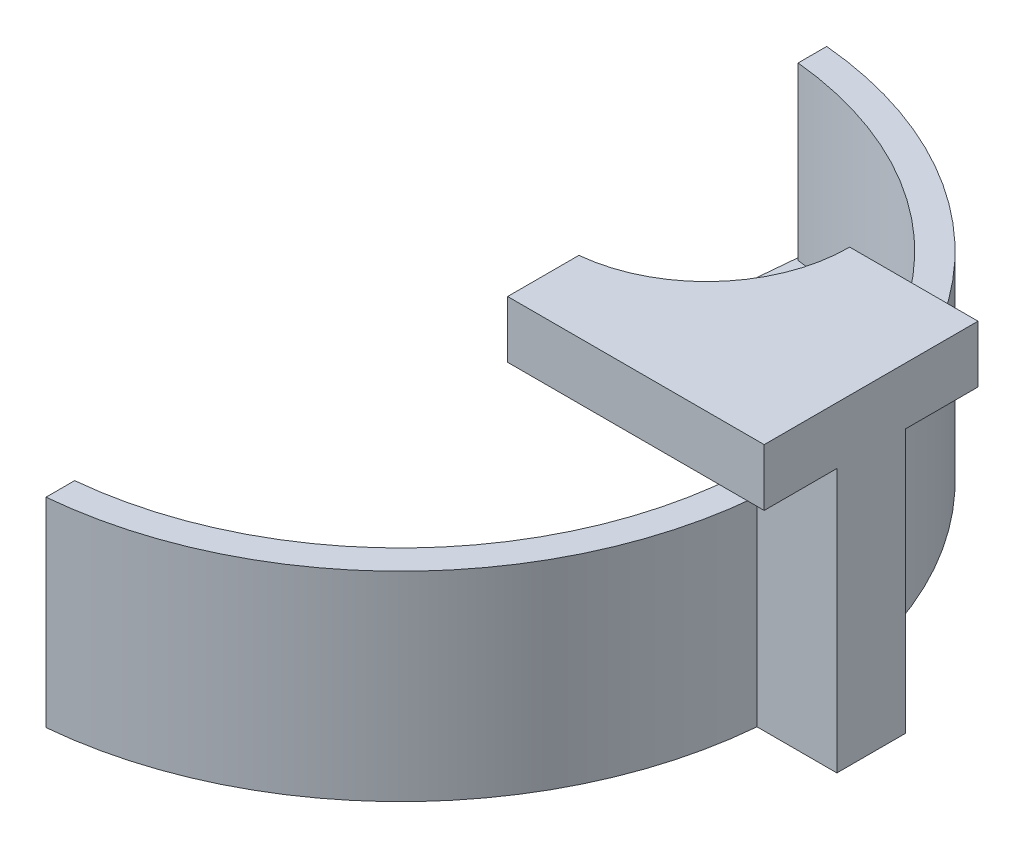
from build123d import *

# Parameters (mm, degrees)
BOSS_EXTRUDE3_DEPTH      = 12
BOSS_EXTRUDE4_START      = -2
BOSS_EXTRUDE4_DEPTH      = 2
SKETCH3_W                = 6
SKETCH3_H                = 4.8
BOSS_EXTRUDE5_DEPTH      = 20
BOSS_EXTRUDE6_DEPTH      = 2.5
BOSS_EXTRUDE6_DEPTH_BACK = 1.5
SKETCH4_W                = 18
SKETCH4_H                = 15
CUT_EXTRUDE2_DEPTH       = 5


with BuildPart() as part:
    # Sketch1 → Boss-Extrude3 (new body)
    with BuildSketch(Plane(origin=(0, 0, 0), x_dir=(1, 0, 0), z_dir=(0, 1, 0))):
        with BuildLine():
            Line((2.5, 27.386127875), (2.5, 25.377155081))
            ThreePointArc((2.5, 25.377155081), (25.5, 0), (2.5, -25.377155081))
            Line((2.5, -25.377155081), (2.5, -27.386127875))
            ThreePointArc((2.5, -27.386127875), (27.5, 0), (2.5, 27.386127875))
        make_face()
    extrude(amount=BOSS_EXTRUDE3_DEPTH)

    # Sketch2 → Boss-Extrude4 (add)
    with BuildSketch(Plane(origin=(0, 0, 0), x_dir=(1, 0, 0), z_dir=(0, 1, 0)).offset(BOSS_EXTRUDE4_START)):
        with BuildLine():
            Line((2.5, 27.386127875), (1.863636364, 20.415113507))
            ThreePointArc((1.863636364, 20.415113507), (20.5, 0), (1.863636364, -20.415113507))
            Line((1.863636364, -20.415113507), (2.5, -27.386127875))
            ThreePointArc((2.5, -27.386127875), (27.5, 0), (2.5, 27.386127875))
        make_face()
    extrude(amount=BOSS_EXTRUDE4_DEPTH)

    # Sketch3 → Boss-Extrude5 (add)
    with BuildSketch(Plane.XZ.offset(2)):
        with Locations((30, 0)):
            Rectangle(SKETCH3_W, SKETCH3_H)
    extrude(amount=-BOSS_EXTRUDE5_DEPTH)

    # Sketch4 → Boss-Extrude6 (add, two sides: drawn at the far end of the back side and taken through both)
    with BuildSketch(Plane(origin=(0, 18, 0), x_dir=(1, 0, 0), z_dir=(0, 1, 0)).offset(-BOSS_EXTRUDE6_DEPTH_BACK)):
        with Locations((24, 0)):
            Rectangle(SKETCH4_W, SKETCH4_H)
    extrude(amount=BOSS_EXTRUDE6_DEPTH + BOSS_EXTRUDE6_DEPTH_BACK)

    # Sketch6 → Cut-Extrude2 (cut)
    with BuildSketch(Plane(origin=(0, 20.5, 0), x_dir=(1, 0, 0), z_dir=(0, 1, 0))):
        with BuildLine():
            Line((15, -2.5), (15, 7.5))
            Line((15, 7.5), (24, 7.5))
            ThreePointArc((24, 7.5), (21.433067029, 0.760239674), (15, -2.5))
        make_face()
    extrude(amount=-CUT_EXTRUDE2_DEPTH, mode=Mode.SUBTRACT)


solid = part.part
